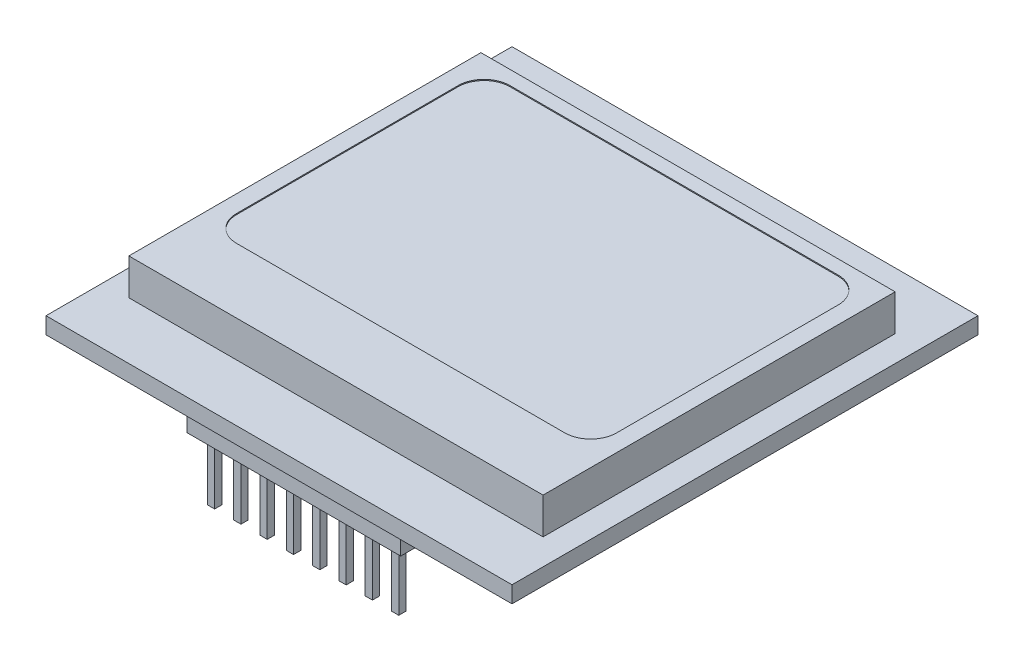
from build123d import *

# Parameters (mm, degrees)
SKETCH1_W           = 45
SKETCH1_H           = 45
BOSS_EXTRUDE1_DEPTH = 1.6
SKETCH2_W           = 40
SKETCH2_H           = 34
BOSS_EXTRUDE2_DEPTH = 3.5
SKETCH4_W           = 20.66
SKETCH4_H           = 2.5
BOSS_EXTRUDE3_DEPTH = 2.8
SKETCH5_W           = 0.7
SKETCH5_H           = 0.7
BOSS_EXTRUDE4_DEPTH = 5.95
CUT_EXTRUDE1_DEPTH  = 0.1


with BuildPart() as part:
    # Sketch1 → Boss-Extrude1 (new body)
    with BuildSketch(Plane(origin=(0, 0, 0), x_dir=(1, 0, 0), z_dir=(0, 1, 0))):
        Rectangle(SKETCH1_W, SKETCH1_H)
    extrude(amount=BOSS_EXTRUDE1_DEPTH)

    # Sketch2 → Boss-Extrude2 (add)
    with BuildSketch(Plane(origin=(0, 1.6, 0), x_dir=(1, 0, 0), z_dir=(0, 1, 0))):
        Rectangle(SKETCH2_W, SKETCH2_H)
    extrude(amount=BOSS_EXTRUDE2_DEPTH)

    # Sketch4 → Boss-Extrude3 (add)
    with BuildSketch(Plane.XZ):
        with Locations((0, 19.825)):
            Rectangle(SKETCH4_W, SKETCH4_H)
    boss_extrude3 = extrude(amount=BOSS_EXTRUDE3_DEPTH)

    # Sketch5 → Boss-Extrude4 (add)
    with BuildSketch(Plane.XZ.offset(2.8)):
        with Locations((1.27, 19.825)):
            Rectangle(SKETCH5_W, SKETCH5_H)
        with Locations((-1.27, 19.825)):
            Rectangle(SKETCH5_W, SKETCH5_H)
        with Locations((3.81, 19.825)):
            Rectangle(SKETCH5_W, SKETCH5_H)
        with Locations((6.35, 19.825)):
            Rectangle(SKETCH5_W, SKETCH5_H)
        with Locations((8.89, 19.825)):
            Rectangle(SKETCH5_W, SKETCH5_H)
        with Locations((-3.81, 19.825)):
            Rectangle(SKETCH5_W, SKETCH5_H)
        with Locations((-6.35, 19.825)):
            Rectangle(SKETCH5_W, SKETCH5_H)
        with Locations((-8.89, 19.825)):
            Rectangle(SKETCH5_W, SKETCH5_H)
    boss_extrude4 = extrude(amount=BOSS_EXTRUDE4_DEPTH)

    # Sketch6 → Cut-Extrude1 (cut)
    with BuildSketch(Plane(origin=(0, 5.1, 0), x_dir=(1, 0, 0), z_dir=(0, 1, 0))):
        with BuildLine():
            Line((-15.85, 15.65), (15.85, 15.65))
            ThreePointArc((15.85, 15.65), (17.617766953, 14.917766953), (18.35, 13.15))
            Line((18.35, 13.15), (18.35, -8.25))
            ThreePointArc((18.35, -8.25), (17.617766953, -10.017766953), (15.85, -10.75))
            Line((15.85, -10.75), (-15.85, -10.75))
            ThreePointArc((-15.85, -10.75), (-17.617766953, -10.017766953), (-18.35, -8.25))
            Line((-18.35, -8.25), (-18.35, 13.15))
            ThreePointArc((-18.35, 13.15), (-17.617766953, 14.917766953), (-15.85, 15.65))
        make_face()
    extrude(amount=-CUT_EXTRUDE1_DEPTH, mode=Mode.SUBTRACT)

    # Mirror1: Boss-Extrude3, Boss-Extrude4 across plane
    add(boss_extrude3.mirror(Plane.XY))
    add(boss_extrude4.mirror(Plane.XY))


solid = part.part
